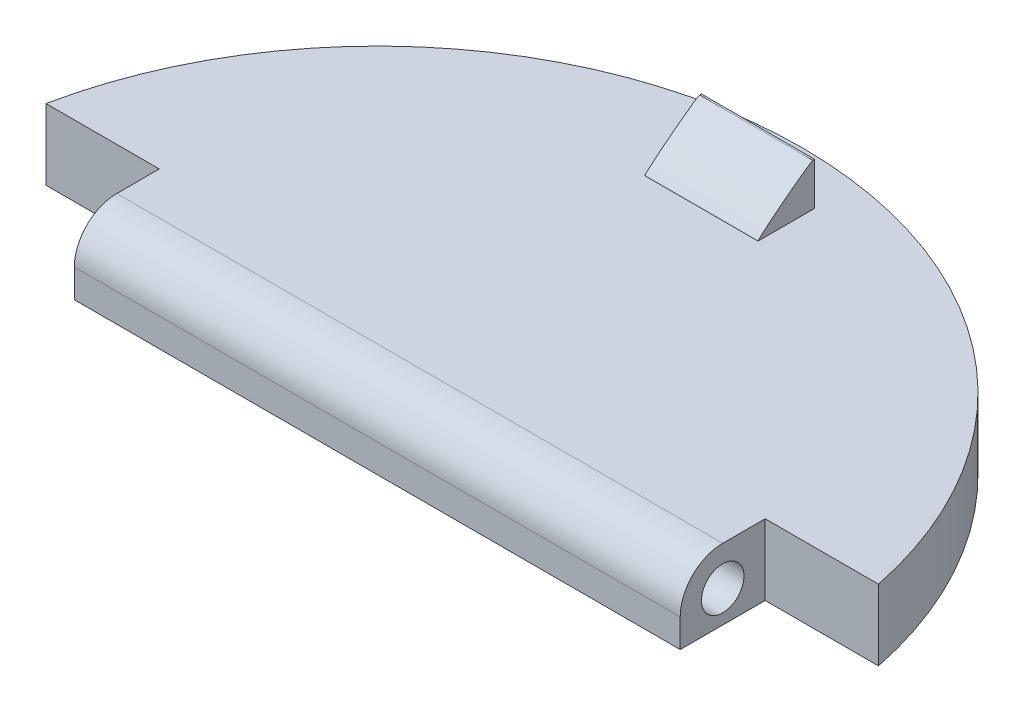
from build123d import *

# Parameters (mm, degrees)
BOSS_EXTRUDE1_DEPTH = 5
SKETCH3_W           = 8
SKETCH3_H           = 4
BOSS_EXTRUDE2_DEPTH = 3
FILLET1_START       = -3.841593316
FILLET1_DEPTH       = 8
CUT_EXTRUDE1_START  = -10
CUT_EXTRUDE1_DEPTH  = 10
FILLET2_R           = 3
SKETCH6_R           = 1.5
CUT_EXTRUDE2_DEPTH  = 5
SKETCH7_R           = 1.25
CUT_EXTRUDE3_DEPTH  = 5


with BuildPart() as part:
    # Sketch1 → Boss-Extrude1 (new body)
    with BuildSketch(Plane(origin=(0, 0, 0), x_dir=(1, 0, 0), z_dir=(0, 1, 0))):
        with BuildLine():
            Line((-30, 0), (30, 0))
            ThreePointArc((30, 0), (0, 30), (-30, 0))
        make_face()
    extrude(amount=BOSS_EXTRUDE1_DEPTH)

    # Sketch3 → Boss-Extrude2 (add)
    with BuildSketch(Plane(origin=(0, 5, 0), x_dir=(1, 0, 0), z_dir=(0, 1, 0))):
        with Locations((0.158406684, 24.731666579)):
            Rectangle(SKETCH3_W, SKETCH3_H)
    extrude(amount=BOSS_EXTRUDE2_DEPTH)

    # Fillet1: read off the stored shape, not the designer's step
    # Fillet1 outline → Fillet1 (cut)
    with BuildSketch(Plane.YZ.offset(FILLET1_START)):
        with BuildLine():
            Line((8, -22.731666579), (5, -22.731666579))
            add(Edge.make_bspline(
                [(5, -22.731666579), (8, -23.506263249), (8, -26.604649926)],
                knots=[0, 0, 0, 1, 1, 1], degree=2, weights=[1, 0.057495957, 1]))
            Line((8, -26.604649926), (8, -22.731666579))
        make_face()
    extrude(amount=FILLET1_DEPTH, mode=Mode.SUBTRACT)

    # Sketch5 → Cut-Extrude1 (cut)
    with BuildSketch(Plane(origin=(0, 5, 0), x_dir=(1, 0, 0), z_dir=(0, 1, 0)).offset(CUT_EXTRUDE1_START)):
        with BuildLine():
            Line((-21.393876913, 0), (-21.393876913, 6))
            Line((-21.393876913, 6), (-29.393876913, 6))
            ThreePointArc((-29.393876913, 6), (-29.84808459, 3.01526886), (-30, 0))
            Line((-30, 0), (-21.393876913, 0))
        make_face()
        with BuildLine():
            Line((21.393876913, 6), (29.393876913, 6))
            ThreePointArc((29.393876913, 6), (29.84808459, 3.01526886), (30, 0))
            Line((30, 0), (21.393876913, 0))
            Line((21.393876913, 0), (21.393876913, 6))
        make_face()
    extrude(amount=CUT_EXTRUDE1_DEPTH, mode=Mode.SUBTRACT)

    # Fillet2
    fillet2_edges = [part.edges().sort_by_distance(p)[0] for p in [
        (0, 5, 0),
    ]]
    fillet(fillet2_edges, radius=FILLET2_R)

    # Sketch6 → Cut-Extrude2 (cut)
    with BuildSketch(Plane(origin=(21.393876913, 0, 0), x_dir=(0, 0, -1), z_dir=(1, 0, 0))):
        with Locations((3, 2.25)):
            Circle(SKETCH6_R)
    extrude(amount=-CUT_EXTRUDE2_DEPTH, mode=Mode.SUBTRACT)

    # Sketch7 → Cut-Extrude3 (cut)
    with BuildSketch(Plane.ZY.offset(21.393876913)):
        with Locations((-3, 2.25)):
            Circle(SKETCH7_R)
    extrude(amount=-CUT_EXTRUDE3_DEPTH, mode=Mode.SUBTRACT)


solid = part.part
